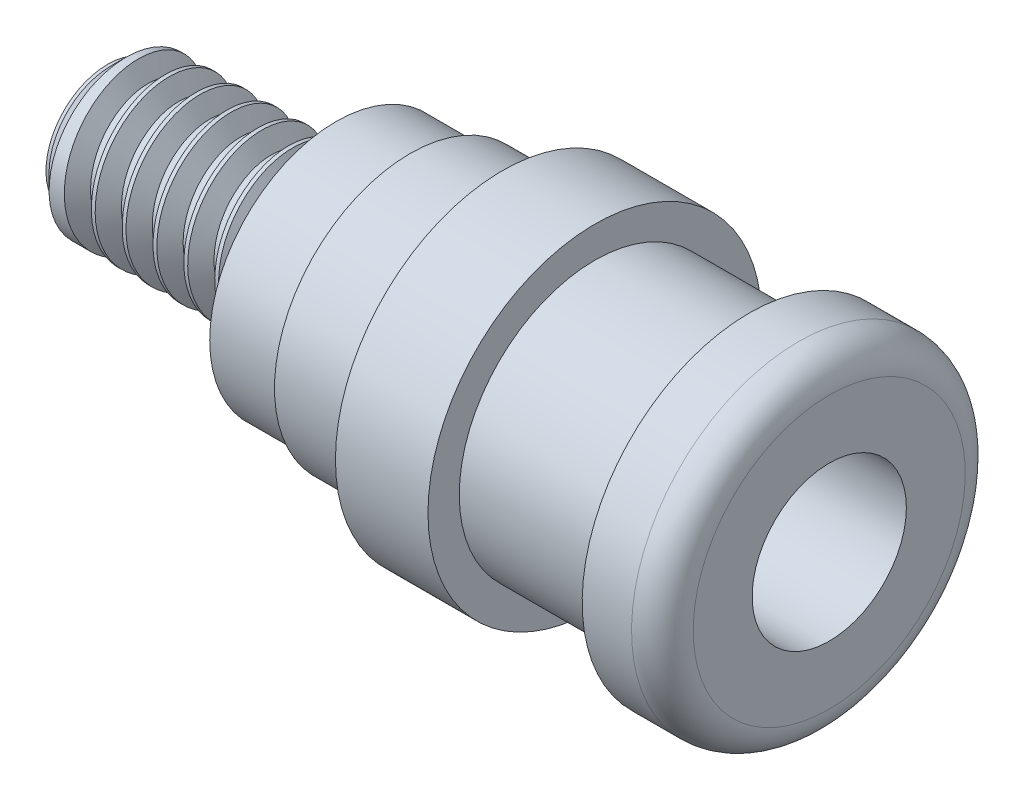
from build123d import *

# Parameters (mm, degrees)
FILLET1_R           = 1
SKETCH13_R          = 6.871303308
SKETCH13_R_2        = 3.683
BOSS_EXTRUDE5_DEPTH = 3.302
CUT_EXTRUDE1_START  = -16.764
SKETCH11_R          = 3.175
CUT_EXTRUDE1_DEPTH  = 16.764
FILLET2_R           = 1.27
SKETCH15_R          = 6.871303308
SKETCH15_R_2        = 5.583057282
BOSS_EXTRUDE6_DEPTH = 3.81
THREAD1_PITCH       = 1.27
SKETCH20_R          = 2.54
BOSS_EXTRUDE7_DEPTH = 0.762
CHAMFER1_SIZE       = 0.635


# Some blends are built 0.0001 mm under size
with BuildPart() as part:
    # Sketch2 → Revolve1 (revolve)
    with BuildSketch(Plane.XY):
        Polygon((0, 0), (0, 5.083057282), (-0.75, 5.083057282), (-0.75, 5.583057282), (-17.26, 5.583057282), (-17.26, 5.202057282), (-20.308, 5.202057282), (-20.308, 3.175), (-28.95, 3.175), (-28.95, 0), align=None)
    revolve(axis=Axis((-28.95, 0, 0), (-1, 0, 0)))

    # Fillet1
    # the kernel refuses this fillet: 1 mm, written as the material it takes off along each edge
    with BuildSketch(Plane(origin=(0, 0, 0), x_dir=(0, 1, 0), z_dir=(0, 0, 1))) as fillet1_piece_1:
        with BuildLine():
            CenterArc((4.114811445, 1), FILLET1_R, 270, 75.522487814)
            Line((5.083057282, 0.75), (5.102422199, 0.745))
            ThreePointArc((5.102422199, 0.745), (5.103057282, 0.375), (5.103057282, 0))
            Line((5.103057282, 0), (5.083057282, -0.02))
            Line((5.083057282, -0.02), (4.114811445, -0.02))
            Line((4.114811445, -0.02), (4.114811445, 0))
        make_face()
    revolve(axis=Axis((0, 0, 0), (-1, 0, 0)), mode=Mode.SUBTRACT)

    # Sketch13 → Boss-Extrude5 (add)
    with BuildSketch(Plane(origin=(0, 0, 0), x_dir=(0, 0, -1), z_dir=(1, 0, 0))):
        with Locations(Location((0, 0, 0), (0, 0, 90))):
            Circle(SKETCH13_R)
        Circle(SKETCH13_R_2, mode=Mode.SUBTRACT)
    extrude(amount=-BOSS_EXTRUDE5_DEPTH)

    # Sketch11 → Cut-Extrude1 (cut)
    with BuildSketch(Plane(origin=(0, 0, 0), x_dir=(0, 0, -1), z_dir=(1, 0, 0)).offset(CUT_EXTRUDE1_START)):
        with Locations(Location((0, 0, 0), (0, 0, 90))):
            Circle(SKETCH11_R)
    extrude(amount=CUT_EXTRUDE1_DEPTH, mode=Mode.SUBTRACT)

    # Fillet2
    fillet2_edges = [part.edges().sort_by_distance(p)[0] for p in [
        (0, -6.871303308, 0),
    ]]
    fillet(fillet2_edges, radius=FILLET2_R)

    # Sketch15 → Boss-Extrude6 (add)
    with BuildSketch(Plane.ZY.offset(9.652)):
        with Locations(Location((0, 0, 0), (0, 0, 90))):
            Circle(SKETCH15_R)
        with Locations(Location((0, 0, 0), (0, 0, 90))):
            Circle(SKETCH15_R_2, mode=Mode.SUBTRACT)
    extrude(amount=BOSS_EXTRUDE6_DEPTH)

    # Thread1: the profile of Thread Profile1 profile screwed along a right-hand helix of 6.804724 turns, 8 arcs to a turn; built about Z, then put on its axis
    thread1_z = Axis((0, 0, 0), (0, 0, 1))
    thread1_corners = [(3.1753, 0, -0.000173205), (3.1753, 0, 1.111423202), (2.487592339, 0, 0.714374998), (2.487592339, 0, 0.396874998)]
    with BuildLine(mode=Mode.PRIVATE) as thread1_profile:
        Line(thread1_corners[0], thread1_corners[1])
        Line(thread1_corners[1], thread1_corners[2])
        Line(thread1_corners[2], thread1_corners[3])
        Line(thread1_corners[3], thread1_corners[0])
    thread1_cap = Face(thread1_profile.wire())
    thread1_turn_angles = [0, 22.5, 45, 67.5, 90, 112.5, 135, 157.5, 180, 202.5, 225, 247.5, 270, 292.5, 315, 337.5, 360]
    thread1_turn_weights = [1, 0.9238795325112867, 1, 0.9238795325112867, 1, 0.9238795325112867, 1, 0.9238795325112867, 1, 0.9238795325112867, 1, 0.9238795325112867, 1, 0.9238795325112867, 1, 0.9238795325112867, 1]
    thread1_turn_rails = [Edge.make_bspline([Vector(p[0], p[1], 0).rotate(thread1_z, thread1_turn_angles[k]) / thread1_turn_weights[k] + Vector(0, 0, p[2] + THREAD1_PITCH * thread1_turn_angles[k] / 360) for k in range(17)], [0, 0, 0, 1, 1, 2, 2, 3, 3, 4, 4, 5, 5, 6, 6, 7, 7, 8, 8, 8], 2, thread1_turn_weights) for p in thread1_corners]
    thread1_turn_sides = [Face.make_surface_from_curves(thread1_turn_rails[p[0]], thread1_turn_rails[p[1]]) for p in [(0, 1), (1, 2), (2, 3), (3, 0)]]
    thread1_last_angles = [2160, 2182.5, 2205, 2227.5, 2250, 2272.5, 2295, 2317.5, 2340, 2362.5, 2385, 2407.5, 2430, 2439.850393701, 2449.700787402]
    thread1_last_weights = [1, 0.9238795325112867, 1, 0.9238795325112867, 1, 0.9238795325112867, 1, 0.9238795325112867, 1, 0.9238795325112867, 1, 0.9238795325112867, 1, 0.9852578119729032, 1]
    thread1_last_rails = [Edge.make_bspline([Vector(p[0], p[1], 0).rotate(thread1_z, thread1_last_angles[k]) / thread1_last_weights[k] + Vector(0, 0, p[2] + THREAD1_PITCH * thread1_last_angles[k] / 360) for k in range(15)], [0, 0, 0, 1, 1, 2, 2, 3, 3, 4, 4, 5, 5, 6, 6, 7, 7, 7], 2, thread1_last_weights) for p in thread1_corners]
    thread1_last_sides = [Face.make_surface_from_curves(thread1_last_rails[p[0]], thread1_last_rails[p[1]]) for p in [(0, 1), (1, 2), (2, 3), (3, 0)]]
    thread1 = Plane(origin=(-28.95, 0, 0), x_dir=(0, 0, -1), z_dir=(1, 0, 0)) * Solid(Shell([*[p.moved(Location((0, 0, THREAD1_PITCH * i))) for i in range(6) for p in thread1_turn_sides], *thread1_last_sides, thread1_cap, thread1_cap.rotate(thread1_z, 2449.700787402).moved(Location((0, 0, THREAD1_PITCH * 2449.700787402 / 360)))]))
    add(thread1, mode=Mode.SUBTRACT)

    # Sketch20 → Boss-Extrude7 (add)
    with BuildSketch(Plane.ZY.offset(28.95)):
        with Locations(Location((0, 0, 0), (0, 0, 90))):
            Circle(SKETCH20_R)
    extrude(amount=BOSS_EXTRUDE7_DEPTH)

    # Chamfer1
    chamfer1_edges = [part.edges().sort_by_distance(p)[0] for p in [
        (-28.95, -2.54, 0),
    ]]
    chamfer(chamfer1_edges, length=CHAMFER1_SIZE - 0.0001)  # a hair under: the kernel refuses the full size


solid = part.part
